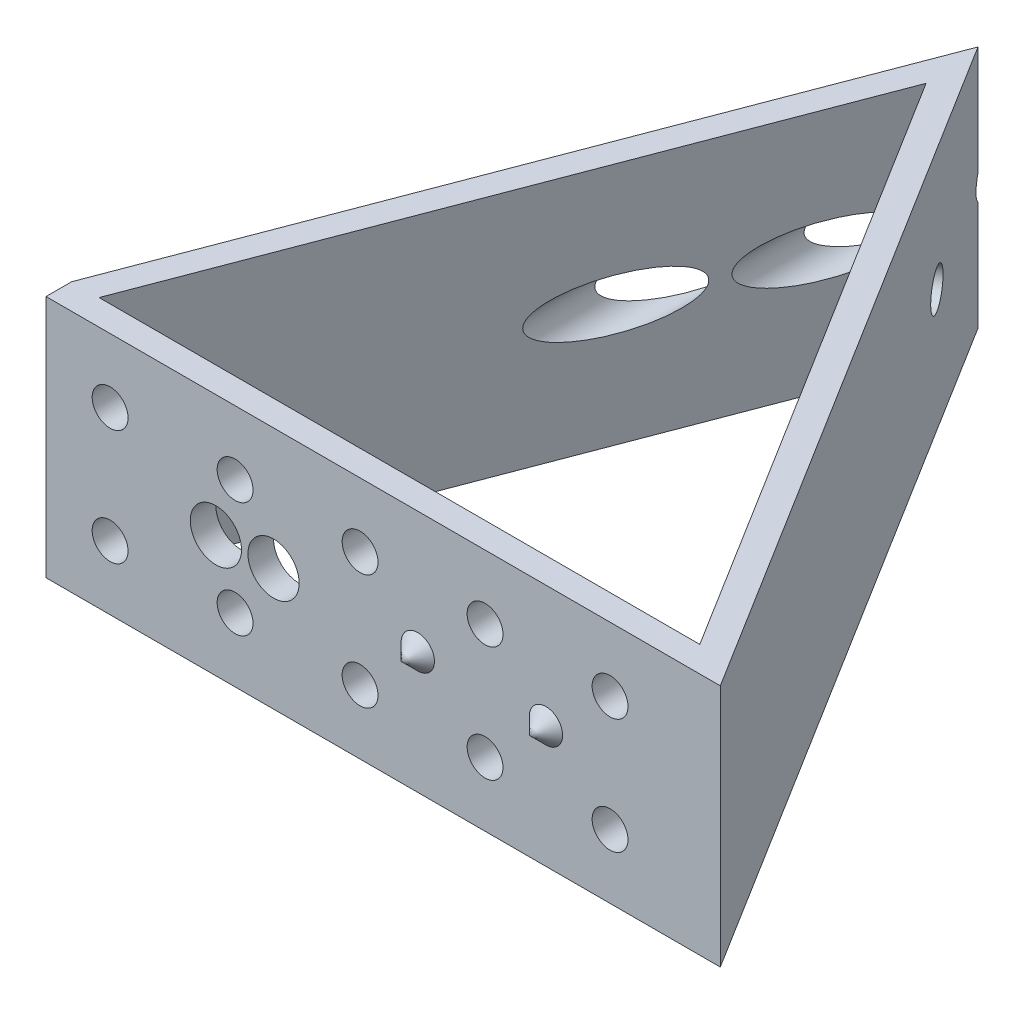
from build123d import *

# Parameters (mm, degrees)
SKETCH1_W           = 49
SKETCH1_H           = 19
BOSS_EXTRUDE1_DEPTH = 2
SKETCH3_R           = 1.4
CUT_EXTRUDE1_DEPTH  = 27.353367906
SKETCH5_R           = 2
CUT_EXTRUDE2_DEPTH  = 10
SKETCH2_R           = 1.3
BOSS_EXTRUDE2_DEPTH = 2.5
BOSS_EXTRUDE3_DEPTH = 19
BOSS_EXTRUDE4_DEPTH = 19
SKETCH7_R           = 2
CUT_EXTRUDE3_DEPTH  = 60.183519481
SKETCH8_R           = 1.5
CUT_EXTRUDE4_DEPTH  = 2


# Read off the part's stored shape, not the designer's step: Draft1
with BuildPart() as part:
    # Sketch1 → Boss-Extrude1 (new body)
    with BuildSketch(Plane.XY):
        Rectangle(SKETCH1_W, SKETCH1_H)
    extrude(amount=BOSS_EXTRUDE1_DEPTH)

    # Sketch3 → Cut-Extrude1 (cut, through all)
    with BuildSketch(Plane.XY.offset(2)):
        with Locations((19.5, 4.5)):
            Circle(SKETCH3_R)
        with Locations((9.75, 4.5)):
            Circle(SKETCH3_R)
        with Locations((0, 4.5)):
            Circle(SKETCH3_R)
        with Locations((-9.75, 4.5)):
            Circle(SKETCH3_R)
        with Locations((-19.5, 4.5)):
            Circle(SKETCH3_R)
        with Locations((-19.5, -4.5)):
            Circle(SKETCH3_R)
        with Locations((-9.75, -4.5)):
            Circle(SKETCH3_R)
        with Locations((0, -4.5)):
            Circle(SKETCH3_R)
        with Locations((9.75, -4.5)):
            Circle(SKETCH3_R)
        with Locations((19.5, -4.5)):
            Circle(SKETCH3_R)
    extrude(amount=-CUT_EXTRUDE1_DEPTH, mode=Mode.SUBTRACT)

    # Sketch5 → Cut-Extrude2 (cut)
    with BuildSketch(Plane.XY.offset(2)):
        with Locations((-6.75, 0)):
            Circle(SKETCH5_R)
        with Locations((-11.25, 0)):
            Circle(SKETCH5_R)
    extrude(amount=-CUT_EXTRUDE2_DEPTH, mode=Mode.SUBTRACT)

    # Sketch2 → Boss-Extrude2 (add)
    with BuildSketch(Plane.XY.offset(2)):
        with Locations((4.5, 0)):
            Circle(SKETCH2_R)
        with Locations((14.5, 0)):
            Circle(SKETCH2_R)
    extrude(amount=BOSS_EXTRUDE2_DEPTH)

    # Draft1 outline → Draft1 (revolve, cut)
    with BuildSketch(Plane(origin=(4.5, 0, 0), x_dir=(1, 0, 0), z_dir=(0, -1, 0))):
        Polygon((1.3, 2), (1.3, 4.5), (0, 4.5), (0, 3.3), align=None)
    revolve(axis=Axis((4.5, 0, 0), (0, 0, 1)), mode=Mode.SUBTRACT)

    # Draft1 2 outline → Draft1 2 (revolve, cut)
    with BuildSketch(Plane(origin=(14.5, 0, 0), x_dir=(1, 0, 0), z_dir=(0, -1, 0))):
        Polygon((1.3, 2), (1.3, 4.5), (0, 4.5), (0, 3.3), align=None)
    revolve(axis=Axis((14.5, 0, 0), (0, 0, 1)), mode=Mode.SUBTRACT)

    # Sketch4 → Boss-Extrude3 (add)
    with BuildSketch(Plane.XZ.offset(9.5)):
        Polygon((-24.5, 0), (-17.386542933, -18.692210371), (-15.517321896, -17.980864664), (-22.360071163, 0), align=None)
    extrude(amount=-BOSS_EXTRUDE3_DEPTH)

    # Sketch6 → Boss-Extrude4 (add)
    with BuildSketch(Plane.XZ.offset(9.5)):
        Polygon((-15.517321896, -17.980864664), (-4.576428495, -46.730525927), (24.5, 0), (24.5, 2), (28.099977552, 2), (-5.010300383, -51.213574761), (-17.386542933, -18.692210371), align=None)
    extrude(amount=-BOSS_EXTRUDE4_DEPTH)

    # Sketch7 → Cut-Extrude3 (cut, through all)
    with BuildSketch(Plane(origin=(0, 0, 0), x_dir=(-1, 0, 0), z_dir=(0, 0, -1))):
        with Locations(Location((11.25, 0, 0), (0, 0, 180))):
            Circle(SKETCH7_R)
        with Locations(Location((6.75, 0, 0), (0, 0, 180))):
            Circle(SKETCH7_R)
    extrude(amount=CUT_EXTRUDE3_DEPTH, mode=Mode.SUBTRACT)

    # Sketch8 → Cut-Extrude4 (cut)
    with BuildSketch(Plane(origin=(19.36021452, 0, -12.046213518), x_dir=(-0.5282973915815173, 0, -0.849059400777216), z_dir=(0.8490594007772159, 0, -0.5282973915815172))):
        with Locations((36.130295721, 0)):
            Circle(SKETCH8_R)
    extrude(amount=-CUT_EXTRUDE4_DEPTH, mode=Mode.SUBTRACT)


solid = part.part
